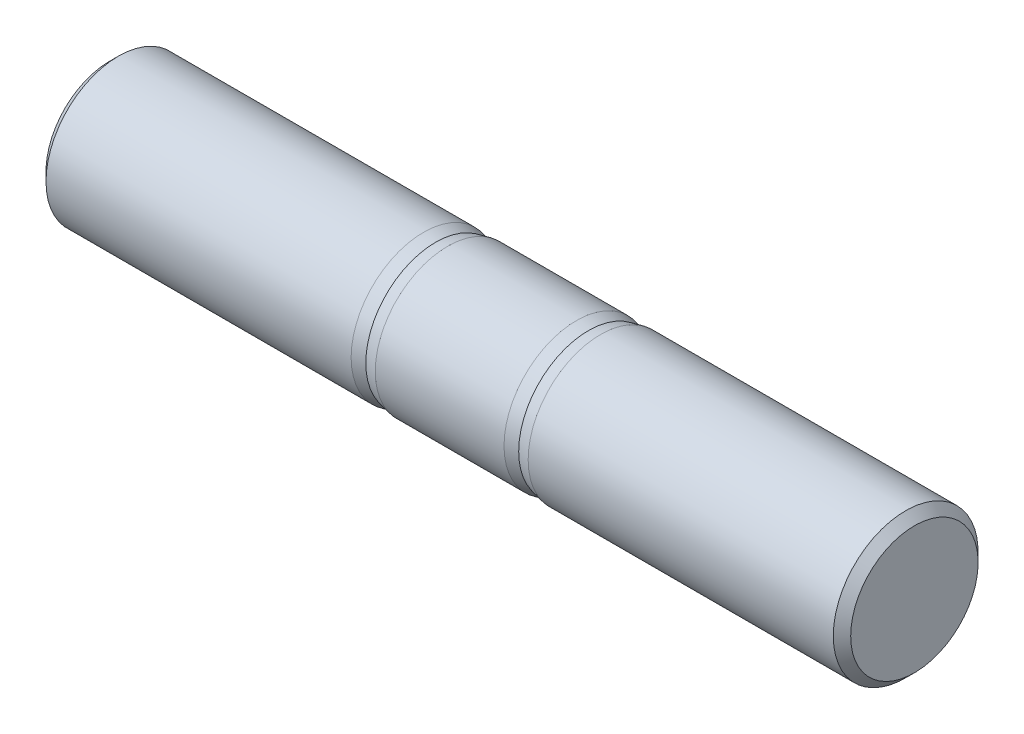
from build123d import *

# Parameters (mm, degrees)
HEADCHAMFER_SIZE = 2.165


with BuildPart() as part:
    # Sketch1 → Base (revolve)
    with BuildSketch(Plane.XY):
        Polygon((0, 0), (0, 18), (78, 18), (84, 16.701), (116, 16.701), (122, 18), (200, 18), (200, 0), align=None)
    revolve(axis=Axis((-1.310841664, 0, 0), (1, 0, 0)))

    # HeadChamfer
    headchamfer_edges = [part.edges().sort_by_distance(p)[0] for p in [
        (0, -18, 0),
        (200, -18, 0),
    ]]
    chamfer(headchamfer_edges, length=HEADCHAMFER_SIZE)

    # Sketch4 → BaseBody (revolve)
    with BuildSketch(Plane.XY):
        Polygon((78, 16.701), (84, 18), (116, 18), (122, 16.701), align=None)
    revolve(axis=Axis((-7.809086942, 0, 0), (1, 0, 0)))


solid = part.part
